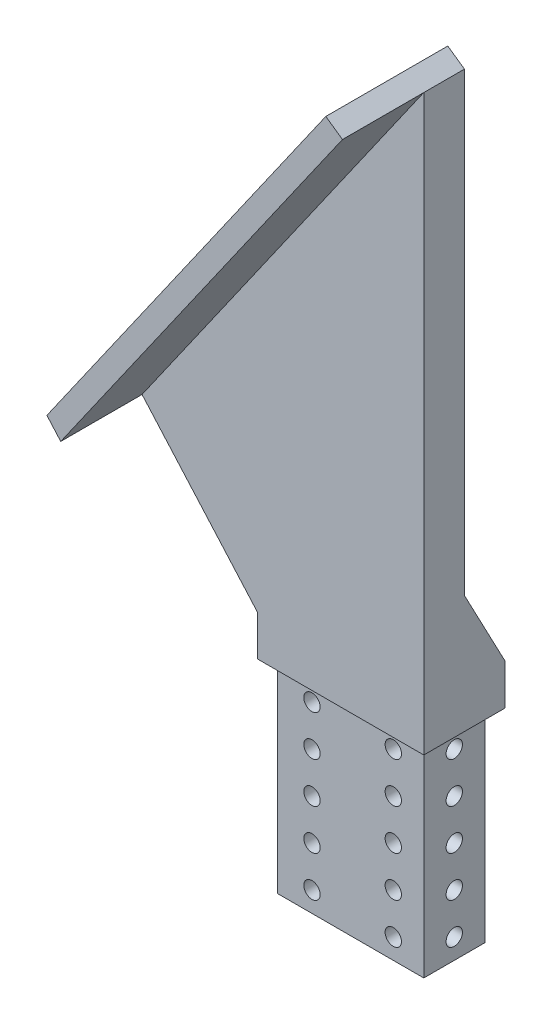
from build123d import *

# Parameters (mm, degrees)
BOSS_EXTRUDE1_DEPTH     = 25.4
SKETCH2_W               = 52
SKETCH2_H               = 63.5
CUT_EXTRUDE1_DEPTH      = 3.175
SKETCH3_W               = 25.4
SKETCH3_H               = 63.5
CUT_EXTRUDE2_DEPTH      = 3.175
SKETCH4_W               = 52
SKETCH4_H               = 63.5
CUT_EXTRUDE3_DEPTH      = 3.175
SKETCH5_W               = 25.4
SKETCH5_H               = 63.5
CUT_EXTRUDE4_DEPTH      = 3.175
SKETCH6_R               = 2.5527
CUT_EXTRUDE5_DEPTH      = 298.353242163
SKETCH7_R               = 2.5527
CUT_EXTRUDE6_DEPTH      = 296.987652825
SKETCH8_W               = 101
SKETCH8_H               = 177.8
CUT_EXTRUDE7_DEPTH      = 298.607392381
CUT_EXTRUDE8_DEPTH      = 275.521693132
CUT_EXTRUDE8_DEPTH_BACK = 275.521693132
CUT_EXTRUDE9_DEPTH      = 275.521693132
CUT_EXTRUDE10_DEPTH     = 271.218574342
BOSS_EXTRUDE2_DEPTH     = 25.4
CUT_EXTRUDE11_DEPTH     = 266.687182276
CUT_EXTRUDE12_DEPTH     = 262.717982977
CUT_EXTRUDE13_DEPTH     = 268.931768254


with BuildPart() as part:
    # Sketch1 → Boss-Extrude1 (new body)
    with BuildSketch(Plane.XY):
        Polygon((0, 0), (0, 76.2), (-101, 76.2), (-101, 254), (153, 254), (153, 76.2), (52, 76.2), (52, 0), align=None)
    extrude(amount=BOSS_EXTRUDE1_DEPTH)

    # Sketch2 → Cut-Extrude1 (cut)
    with BuildSketch(Plane.XY.offset(25.4)):
        with Locations((26, 31.75)):
            Rectangle(SKETCH2_W, SKETCH2_H)
    extrude(amount=-CUT_EXTRUDE1_DEPTH, mode=Mode.SUBTRACT)

    # Sketch3 → Cut-Extrude2 (cut)
    with BuildSketch(Plane.ZY):
        with Locations((12.7, 31.75)):
            Rectangle(SKETCH3_W, SKETCH3_H)
    extrude(amount=-CUT_EXTRUDE2_DEPTH, mode=Mode.SUBTRACT)

    # Sketch4 → Cut-Extrude3 (cut)
    with BuildSketch(Plane(origin=(0, 0, 0), x_dir=(-1, 0, 0), z_dir=(0, 0, -1))):
        with Locations((-26, 31.75)):
            Rectangle(SKETCH4_W, SKETCH4_H)
    extrude(amount=-CUT_EXTRUDE3_DEPTH, mode=Mode.SUBTRACT)

    # Sketch5 → Cut-Extrude4 (cut)
    with BuildSketch(Plane(origin=(52, 0, 0), x_dir=(0, 0, -1), z_dir=(1, 0, 0))):
        with Locations((-12.7, 31.75)):
            Rectangle(SKETCH5_W, SKETCH5_H)
    extrude(amount=-CUT_EXTRUDE4_DEPTH, mode=Mode.SUBTRACT)

    # Sketch6 → Cut-Extrude5 (cut, through all)
    with BuildSketch(Plane(origin=(0, 0, 3.175), x_dir=(-1, 0, 0), z_dir=(0, 0, -1))):
        with Locations((-39.3, 57.15)):
            Circle(SKETCH6_R)
        with Locations((-13.9, 57.15)):
            Circle(SKETCH6_R)
        with Locations((-39.3, 44.45)):
            Circle(SKETCH6_R)
        with Locations((-13.9, 44.45)):
            Circle(SKETCH6_R)
        with Locations((-39.3, 31.75)):
            Circle(SKETCH6_R)
        with Locations((-13.9, 31.75)):
            Circle(SKETCH6_R)
        with Locations((-39.3, 19.05)):
            Circle(SKETCH6_R)
        with Locations((-13.9, 19.05)):
            Circle(SKETCH6_R)
        with Locations((-39.3, 6.35)):
            Circle(SKETCH6_R)
        with Locations((-13.9, 6.35)):
            Circle(SKETCH6_R)
    extrude(amount=-CUT_EXTRUDE5_DEPTH, mode=Mode.SUBTRACT)

    # Sketch7 → Cut-Extrude6 (cut, through all)
    with BuildSketch(Plane(origin=(48.825, 0, 0), x_dir=(0, 0, -1), z_dir=(1, 0, 0))):
        with Locations((-12.7, 57.15)):
            Circle(SKETCH7_R)
        with Locations((-12.7, 44.45)):
            Circle(SKETCH7_R)
        with Locations((-12.7, 31.75)):
            Circle(SKETCH7_R)
        with Locations((-12.7, 19.05)):
            Circle(SKETCH7_R)
        with Locations((-12.7, 6.35)):
            Circle(SKETCH7_R)
    extrude(amount=-CUT_EXTRUDE6_DEPTH, mode=Mode.SUBTRACT)

    # Sketch8 → Cut-Extrude7 (cut, through all)
    with BuildSketch(Plane.XY.offset(25.4)):
        with Locations((102.5, 165.1)):
            Rectangle(SKETCH8_W, SKETCH8_H)
    extrude(amount=-CUT_EXTRUDE7_DEPTH, mode=Mode.SUBTRACT)

    # Sketch9 → Cut-Extrude8 (cut, two sides: drawn at the far end of the back side and taken through both)
    with BuildSketch(Plane.XY.offset(25.4).offset(-CUT_EXTRUDE8_DEPTH_BACK)):
        Polygon((52, 254), (52, 242.697), (35.85764308, 254), align=None)
    extrude(amount=CUT_EXTRUDE8_DEPTH + CUT_EXTRUDE8_DEPTH_BACK, mode=Mode.SUBTRACT)

    # Sketch10 → Cut-Extrude9 (cut, through all)
    with BuildSketch(Plane.XY.offset(25.4)):
        Polygon((35.85764308, 254), (-101, 58.547029828), (-101, 254), align=None)
    extrude(amount=-CUT_EXTRUDE9_DEPTH, mode=Mode.SUBTRACT)

    # Sketch11 → Cut-Extrude10 (cut, through all)
    with BuildSketch(Plane.XY.offset(25.4)):
        Polygon((35.85764308, 254), (46.79768076, 246.339703148), (-82.829822213, 61.212443159), (-93.769859893, 68.872740011), align=None)
    extrude(amount=-CUT_EXTRUDE10_DEPTH, mode=Mode.SUBTRACT)

    # Sketch14 → Boss-Extrude2 (add)
    with BuildSketch(Plane.XY.offset(25.4)):
        Polygon((46.79768076, 246.339703148), (52, 242.697), (-80.388506664, 53.626618092), (-85.590825904, 57.26932124), align=None)
    extrude(amount=BOSS_EXTRUDE2_DEPTH)

    # Sketch15 → Cut-Extrude11 (cut, through all)
    with BuildSketch(Plane.XY.offset(50.8)):
        Polygon((-64.582454489, 76.2), (-72.335421933, 76.2), (-85.590825904, 57.26932124), (-80.388506664, 53.626618092), align=None)
    extrude(amount=-CUT_EXTRUDE11_DEPTH, mode=Mode.SUBTRACT)

    # Sketch16 → Cut-Extrude12 (cut, through all)
    with BuildSketch(Plane(origin=(0, 0, 0), x_dir=(-1, 0, 0), z_dir=(0, 0, -1))):
        Polygon((0, 76.2), (40.323036631, 121.918424261), (72.335421933, 76.2), align=None)
    extrude(amount=-CUT_EXTRUDE12_DEPTH, mode=Mode.SUBTRACT)

    # Sketch17 → Cut-Extrude13 (cut, through all)
    with BuildSketch(Plane(origin=(52, 0, 0), x_dir=(0, 0, -1), z_dir=(1, 0, 0))):
        Polygon((-12.7, 246.339703148), (-12.7, 100.289703148), (0, 76.2), (0, 246.339703148), align=None)
    extrude(amount=-CUT_EXTRUDE13_DEPTH, mode=Mode.SUBTRACT)


solid = part.part
